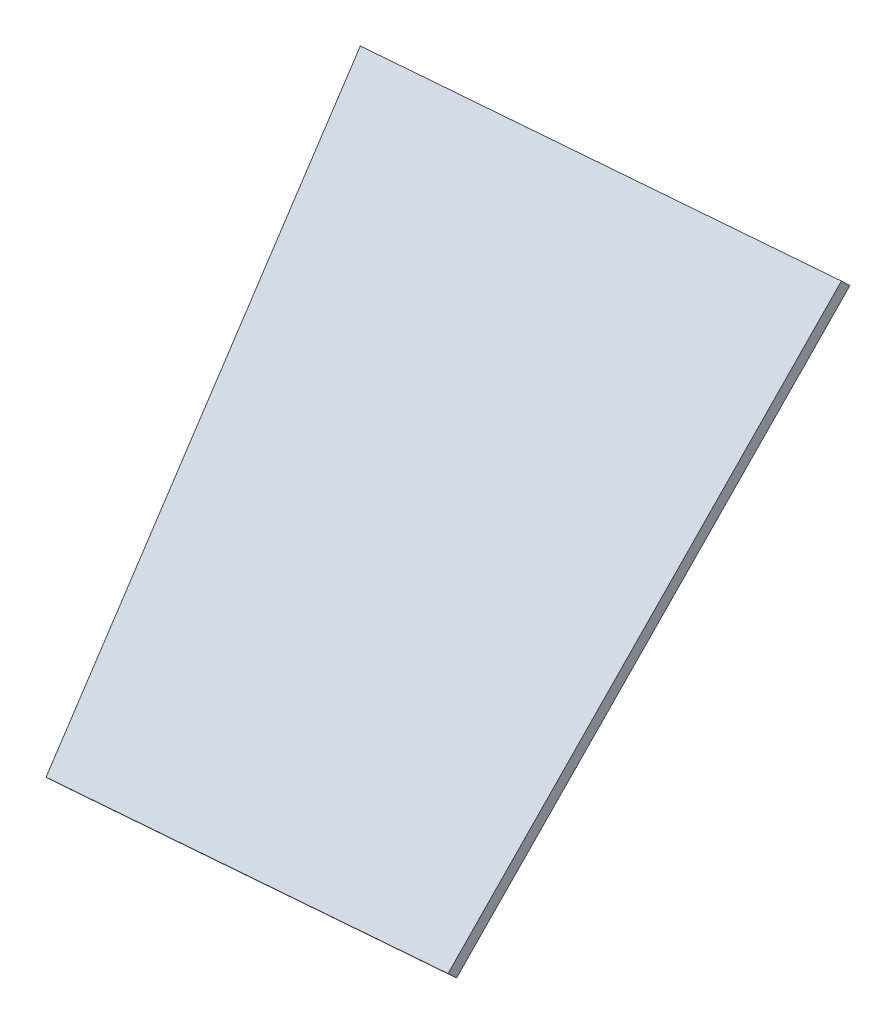
from build123d import *

# Parameters (mm, degrees)
BOSS_EXTRUDE1_DEPTH = 12.7


with BuildPart() as part:
    # PedalBox Floor → Boss-Extrude1 (new body)
    with BuildSketch(Plane(origin=(100.339650508, 1050.390805911, 1100.269301717), x_dir=(-0.997384510869728, 0.06707800452126333, 0.02691985859173624), z_dir=(-0.0658197544203442, -0.6890243741157006, -0.7217431480814438))):
        Polygon((881.737636203, -446.586811602), (869.349442447, -997.475671178), (1230.90224169, -1029.141287047), (1314.464294537, -484.485995808), align=None)
    extrude(amount=BOSS_EXTRUDE1_DEPTH)


solid = part.part
